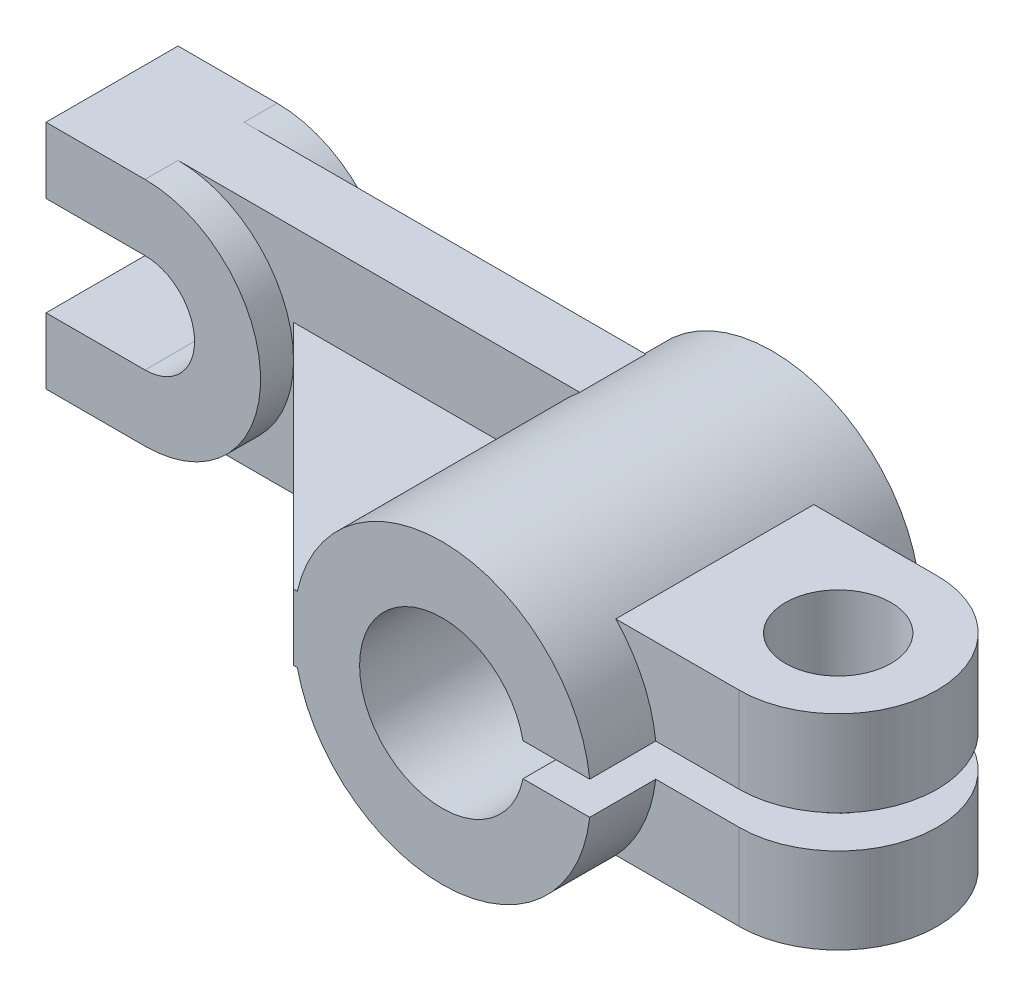
from build123d import *

# Parameters (mm, degrees)
BOSS_EXTRUDE1_DEPTH       = 10
BOSS_EXTRUDE2_DEPTH       = 5
BOSS_EXTRUDE2_DEPTH_BACK  = 15
BOSS_EXTRUDE3_DEPTH       = 35
BOSS_EXTRUDE3_DEPTH_BACK  = 15
RIB27_REACH               = 125.11
SKETCH19_WALL_W           = 287.352003994
SKETCH19_WALL_H           = 10
BOSS_EXTRUDE4_DEPTH       = 5
RIB29_REACH               = 127.025
SKETCH20_WALL_W           = 301.546848684
SKETCH20_WALL_H           = 10
CUT_EXTRUDE1_START        = -5
CUT_EXTRUDE1_DEPTH        = 5
CUT_EXTRUDE2_DEPTH        = 5
SKETCH37_R                = 8
BOSS_EXTRUDE6_DEPTH       = 15.5
BOSS_EXTRUDE11_REACH      = 129.598
BOSS_EXTRUDE11_END_RADIUS = 22.5
SKETCH45_W                = 30
SKETCH45_H                = 15.5
BOSS_EXTRUDE12_REACH      = 129.598
BOSS_EXTRUDE12_END_RADIUS = 22.5
SKETCH48_W                = 30
SKETCH48_H                = 15.5
SKETCH52_W                = 33.733601919
SKETCH52_H                = 5
CUT_EXTRUDE4_DEPTH        = 154.948043183


with BuildPart() as part:
    # Sketch1 → Boss-Extrude1 (new body)
    with BuildSketch(Plane.XY):
        with BuildLine():
            Line((15, 0), (75.857864376, 0))
            ThreePointArc((75.857864376, 0), (67.5, 17.5), (75.857864376, 35))
            Line((75.857864376, 35), (15, 35))
            ThreePointArc((15, 35), (32.5, 17.5), (15, 0))
        make_face()
    extrude(amount=BOSS_EXTRUDE1_DEPTH)

    # Sketch2 → Boss-Extrude2 (add, two sides: drawn at the far end of the back side and taken through both)
    with BuildSketch(Plane.XY.offset(10).offset(-BOSS_EXTRUDE2_DEPTH_BACK)):
        with BuildLine():
            Line((15, 10), (0, 10))
            Line((0, 10), (0, 0))
            Line((0, 0), (15, 0))
            ThreePointArc((15, 0), (32.5, 17.5), (15, 35))
            Line((15, 35), (0, 35))
            Line((0, 35), (0, 25))
            Line((0, 25), (15, 25))
            ThreePointArc((15, 25), (22.5, 17.5), (15, 10))
        make_face()
    extrude(amount=BOSS_EXTRUDE2_DEPTH + BOSS_EXTRUDE2_DEPTH_BACK)

    # Sketch3 → Boss-Extrude3 (add, two sides: drawn at the far end of the back side and taken through both)
    with BuildSketch(Plane.XY.offset(10).offset(-BOSS_EXTRUDE3_DEPTH_BACK)):
        with BuildLine():
            Line((102.247448714, 20), (112.360679775, 20))
            ThreePointArc((112.360679775, 20), (67.5, 17.5), (112.360679775, 15))
            Line((112.360679775, 15), (102.247448714, 15))
            ThreePointArc((102.247448714, 15), (77.5, 17.5), (102.247448714, 20))
        make_face()
    extrude(amount=BOSS_EXTRUDE3_DEPTH + BOSS_EXTRUDE3_DEPTH_BACK)

    # Sketch19 wall → Rib27 (add, up to next)
    with BuildSketch(Plane(origin=(50, 17.5, 18.75), x_dir=(0.894427191, 0, 0.4472135955), z_dir=(0.4472135955, 0, -0.894427191)), mode=Mode.PRIVATE) as rib27_sk1:
        Rectangle(SKETCH19_WALL_W, SKETCH19_WALL_H)
    rib27_tool1 = extrude(rib27_sk1.sketch, amount=RIB27_REACH, mode=Mode.PRIVATE) - part.part
    add(rib27_tool1.solids().sort_by_distance((50, 17.5, 18.75))[0])

    # Sketch21 → Boss-Extrude4 (add)
    with BuildSketch(Plane.XY.offset(45)):
        with BuildLine():
            Line((102.247448714, 20), (112.360679775, 20))
            ThreePointArc((112.360679775, 20), (67.5, 17.5), (112.360679775, 15))
            Line((112.360679775, 15), (102.247448714, 15))
            ThreePointArc((102.247448714, 15), (77.5, 17.5), (102.247448714, 20))
        make_face()
    extrude(amount=BOSS_EXTRUDE4_DEPTH)

    # Sketch20 wall → Rib29 (add, up to next)
    with BuildSketch(Plane(origin=(50, 17.5, 27.5), x_dir=(0.707106781187, 0, 0.707106781187), z_dir=(0.707106781187, 0, -0.707106781187)), mode=Mode.PRIVATE) as rib29_sk1:
        Rectangle(SKETCH20_WALL_W, SKETCH20_WALL_H)
    rib29_tool1 = extrude(rib29_sk1.sketch, amount=RIB29_REACH, mode=Mode.PRIVATE) - part.part
    add(rib29_tool1.solids().sort_by_distance((50, 17.5, 27.5))[0])

    # Sketch23 → Cut-Extrude1 (cut)
    with BuildSketch(Plane.XY.offset(50).offset(CUT_EXTRUDE1_START)):
        with BuildLine():
            Line((102.247448714, 20), (112.360679775, 20))
            ThreePointArc((112.360679775, 20), (67.5, 17.5), (112.360679775, 15))
            Line((112.360679775, 15), (102.247448714, 15))
            ThreePointArc((102.247448714, 15), (77.5, 17.5), (102.247448714, 20))
        make_face()
    extrude(amount=CUT_EXTRUDE1_DEPTH, mode=Mode.SUBTRACT)

    # Sketch25 → Cut-Extrude2 (cut)
    with BuildSketch(Plane.ZY.offset(-67.5)):
        Polygon((45, 17.5), (45, 9.449706044), (52.526454381, 9.449706044), (52.526454381, 28.660137354), (45, 28.660137354), align=None)
    extrude(amount=-CUT_EXTRUDE2_DEPTH, mode=Mode.SUBTRACT)



with BuildPart() as body_2:
    # Sketch37 → Boss-Extrude6 (new, symmetric)
    with BuildSketch(Plane(origin=(0, 17.5, 0), x_dir=(-1, 0, 0), z_dir=(0, -1, 0))):
        with BuildLine():
            Line((-125, -5), (-112.5, -5))
            Line((-112.5, -5), (-112.5, -35))
            Line((-112.5, -35), (-125, -35))
            ThreePointArc((-125, -35), (-140, -20), (-125, -5))
        make_face()
        with Locations((-125, -20)):
            Circle(SKETCH37_R, mode=Mode.SUBTRACT)
    extrude(amount=BOSS_EXTRUDE6_DEPTH, both=True)


with BuildPart() as part_1:
    add(part.part)

    add(body_2.part)  # Boss-Extrude11 merges body 2
    # Boss-Extrude11: up to this cylinder (the profile starts outside it)
    boss_extrude11_end = Plane(origin=(90, 17.5, 20), z_dir=(0, 0, 1)) * Cylinder(BOSS_EXTRUDE11_END_RADIUS, 305.196, mode=Mode.PRIVATE)
    # Sketch45 → Boss-Extrude11 (add, up to the surface)
    with BuildSketch(Plane.ZY.offset(-112.5), mode=Mode.PRIVATE) as boss_extrude11_sk1:
        with Locations((20, 9.75)):
            Rectangle(SKETCH45_W, SKETCH45_H)
    boss_extrude11_tool1 = extrude(boss_extrude11_sk1.sketch, amount=BOSS_EXTRUDE11_REACH, mode=Mode.PRIVATE) - boss_extrude11_end
    add(boss_extrude11_tool1.solids().sort_by_distance((112.5, 9.75, 20))[0])

    # Boss-Extrude12: up to this cylinder (the profile starts outside it)
    boss_extrude12_end = Plane(origin=(90, 17.5, 20), z_dir=(0, 0, 1)) * Cylinder(BOSS_EXTRUDE12_END_RADIUS, 305.196, mode=Mode.PRIVATE)
    # Sketch48 → Boss-Extrude12 (add, up to the surface)
    with BuildSketch(Plane.ZY.offset(-112.5), mode=Mode.PRIVATE) as boss_extrude12_sk1:
        with Locations((20, 25.25)):
            Rectangle(SKETCH48_W, SKETCH48_H)
    boss_extrude12_tool1 = extrude(boss_extrude12_sk1.sketch, amount=BOSS_EXTRUDE12_REACH, mode=Mode.PRIVATE) - boss_extrude12_end
    add(boss_extrude12_tool1.solids().sort_by_distance((112.5, 25.25, 20))[0])

    # Sketch52 → Cut-Extrude4 (cut, through all)
    with BuildSketch(Plane.XY.offset(45)):
        with Locations((129.227480735, 17.5)):
            Rectangle(SKETCH52_W, SKETCH52_H)
    extrude(amount=-CUT_EXTRUDE4_DEPTH, mode=Mode.SUBTRACT)


solid = part_1.part
